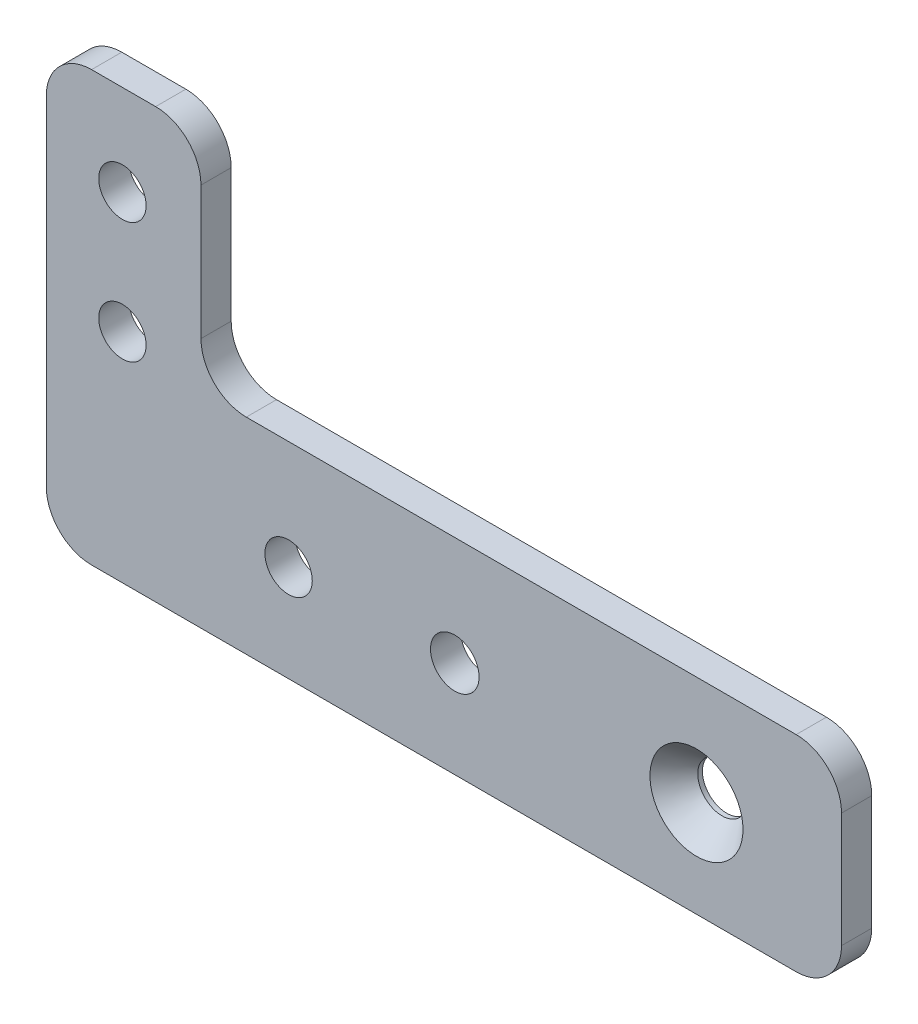
from build123d import *

# Parameters (mm, degrees)
SKETCH1_R                                       = 2.4892
SKETCH1_R_2                                     = 2.5527
BOSS_EXTRUDE1_DEPTH                             = 3.175
FILLET1_R                                       = 4.7625
CSK_FOR_10_FLAT_HEAD_MACHINE_SCREW1_D           = 5.1054
CSK_FOR_10_FLAT_HEAD_MACHINE_SCREW1_DEPTH       = 19.05
CSK_FOR_10_FLAT_HEAD_MACHINE_SCREW1_CSINK_D     = 9.779
CSK_FOR_10_FLAT_HEAD_MACHINE_SCREW1_CSINK_ANGLE = 82
CSK_FOR_10_FLAT_HEAD_MACHINE_SCREW1_TIP         = 1.533816902


with BuildPart() as part:
    # Sketch1 → Boss-Extrude1 (new body)
    with BuildSketch(Plane.XY):
        Polygon((-37.846, 23.8125), (-37.846, -21.2725), (45.72, -21.2725), (45.72, 0.3175), (-21.59, 0.3175), (-21.59, 23.8125), align=None)
        with Locations((-12.3825, -11.1125)):
            Circle(SKETCH1_R, mode=Mode.SUBTRACT)
        with Locations((5.08, -11.1125)):
            Circle(SKETCH1_R_2, mode=Mode.SUBTRACT)
        with Locations((30.48, -11.1125)):
            Circle(SKETCH1_R_2, mode=Mode.SUBTRACT)
        with Locations((-29.845, 1.5875)):
            Circle(SKETCH1_R, mode=Mode.SUBTRACT)
        with Locations((-29.845, 14.2875)):
            Circle(SKETCH1_R, mode=Mode.SUBTRACT)
    extrude(amount=BOSS_EXTRUDE1_DEPTH)

    # Fillet1
    fillet1_edges = [part.edges().sort_by_distance(p)[0] for p in [
        (-37.846, 23.8125, 1.5875),
        (-21.59, 23.8125, 1.5875),
        (-21.59, 0.3175, 1.5875),
        (45.72, 0.3175, 1.5875),
        (45.72, -21.2725, 1.5875),
        (-37.846, -21.2725, 1.5875),
    ]]
    fillet(fillet1_edges, radius=FILLET1_R)

    # CSK for #10 Flat Head Machine Screw1
    with Locations(Plane.XY.offset(3.175)):
        with Locations((30.48, -11.1125)):
            CounterSinkHole(CSK_FOR_10_FLAT_HEAD_MACHINE_SCREW1_D / 2, CSK_FOR_10_FLAT_HEAD_MACHINE_SCREW1_CSINK_D / 2, depth=CSK_FOR_10_FLAT_HEAD_MACHINE_SCREW1_DEPTH, counter_sink_angle=CSK_FOR_10_FLAT_HEAD_MACHINE_SCREW1_CSINK_ANGLE)
            with Locations((0, 0, -(CSK_FOR_10_FLAT_HEAD_MACHINE_SCREW1_DEPTH + CSK_FOR_10_FLAT_HEAD_MACHINE_SCREW1_TIP / 2))):  # 118° drill point
                Cone(0, CSK_FOR_10_FLAT_HEAD_MACHINE_SCREW1_D / 2, CSK_FOR_10_FLAT_HEAD_MACHINE_SCREW1_TIP, mode=Mode.SUBTRACT)


solid = part.part
